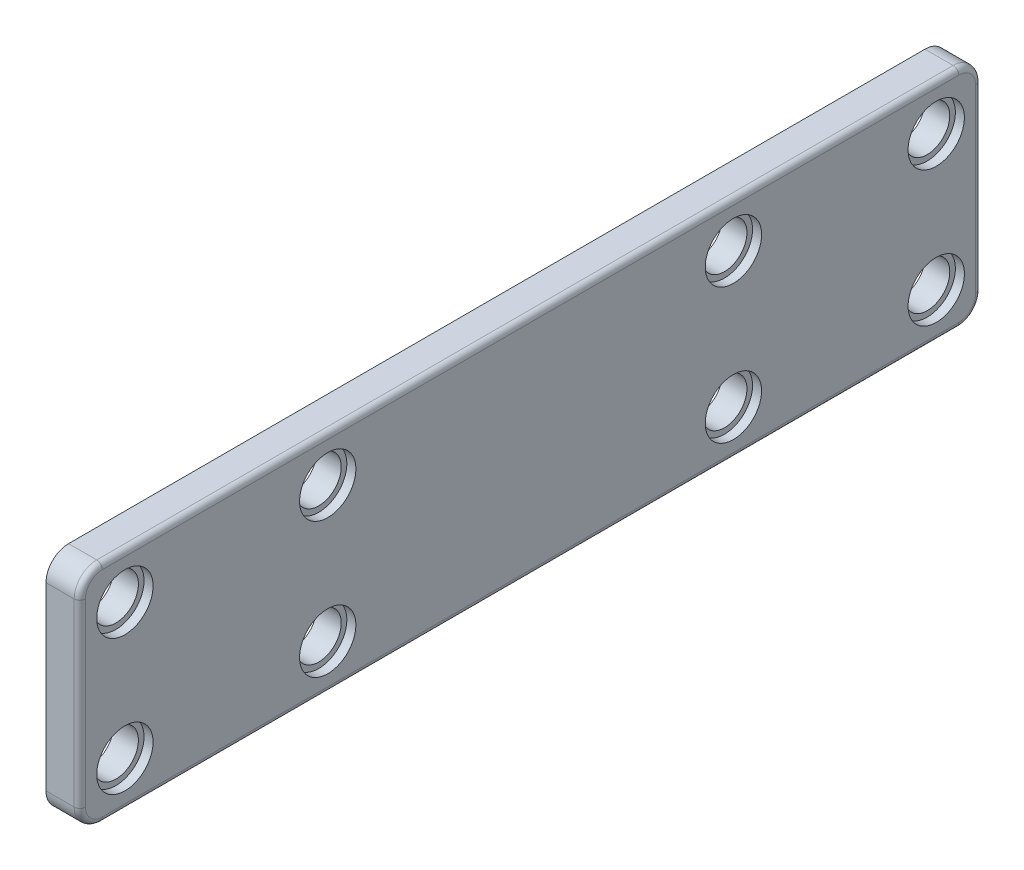
from build123d import *

# Parameters (mm, degrees)
SKETCH2_W            = 3
SKETCH2_H            = 20
BOSS_EXTRUDE2_DEPTH  = 80
FILLET3_R            = 2
FILLET4_R            = 2
FILLET5_R            = 2
FILLET6_R            = 2
LPATTERN1_COUNT      = 2
LPATTERN1_PITCH      = 18
LPATTERN1_COUNT_DIR2 = 2
LPATTERN1_PITCH_DIR2 = 12
FILLET7_R            = 0.5


with BuildPart() as part:
    # Sketch2 → Boss-Extrude2 (new body)
    with BuildSketch(Plane.XY):
        Rectangle(SKETCH2_W, SKETCH2_H)
    extrude(amount=BOSS_EXTRUDE2_DEPTH)

    # Fillet3
    fillet3_edges = [part.edges().sort_by_distance(p)[0] for p in [
        (0, 10, 80),
    ]]
    fillet(fillet3_edges, radius=FILLET3_R)

    # Fillet4
    fillet4_edges = [part.edges().sort_by_distance(p)[0] for p in [
        (0, -10, 80),
    ]]
    fillet(fillet4_edges, radius=FILLET4_R)

    # Fillet5
    fillet5_edges = [part.edges().sort_by_distance(p)[0] for p in [
        (0, 10, 0),
    ]]
    fillet(fillet5_edges, radius=FILLET5_R)

    # Fillet6
    fillet6_edges = [part.edges().sort_by_distance(p)[0] for p in [
        (0, -10, 0),
    ]]
    fillet(fillet6_edges, radius=FILLET6_R)

    # Sketch4 → CBORE for M5 Hex Head Bolt1 (revolve, cut)
    with BuildSketch(Plane(origin=(1.5, 6, 76), x_dir=(0, 0, -1), z_dir=(0, 1, 0))):
        Polygon((0, 0), (0, 5.178090033), (2, 4), (2, 0.8), (2.5, 0.8), (2.5, 0), align=None)
    cbore_for_m5_hex_head_bolt1 = revolve(axis=Axis((7.85, 6, 76), (-1, 0, 0)), mode=Mode.SUBTRACT)

    # LPattern1: CBORE for M5 Hex Head Bolt1 2 × 2
    with Locations(*[(0, -j * LPATTERN1_PITCH_DIR2, -i * LPATTERN1_PITCH) for i in range(LPATTERN1_COUNT) for j in range(LPATTERN1_COUNT_DIR2) if (i, j) != (0, 0)]):
        add(cbore_for_m5_hex_head_bolt1, mode=Mode.SUBTRACT)

    # Mirror16: CBORE for M5 Hex Head Bolt1 across plane
    add(cbore_for_m5_hex_head_bolt1.mirror(Plane.XY.offset(40)), mode=Mode.SUBTRACT)

    # Mirror16 copy 1 sketch → Mirror16 copy 1 (revolve, cut)
    with BuildSketch(Plane(origin=(1.5, -6, 4), x_dir=(0, 0, 1), z_dir=(0, 1, 0))):
        Polygon((0, 0), (0, -5.178090033), (2, -4), (2, -0.8), (2.5, -0.8), (2.5, 0), align=None)
    revolve(axis=Axis((7.85, -6, 4), (1, 0, 0)), mode=Mode.SUBTRACT)

    # Mirror16 copy 2 sketch → Mirror16 copy 2 (revolve, cut)
    with BuildSketch(Plane(origin=(1.5, 6, 22), x_dir=(0, 0, 1), z_dir=(0, 1, 0))):
        Polygon((0, 0), (0, -5.178090033), (2, -4), (2, -0.8), (2.5, -0.8), (2.5, 0), align=None)
    revolve(axis=Axis((7.85, 6, 22), (1, 0, 0)), mode=Mode.SUBTRACT)

    # Mirror16 copy 3 sketch → Mirror16 copy 3 (revolve, cut)
    with BuildSketch(Plane(origin=(1.5, -6, 22), x_dir=(0, 0, 1), z_dir=(0, 1, 0))):
        Polygon((0, 0), (0, -5.178090033), (2, -4), (2, -0.8), (2.5, -0.8), (2.5, 0), align=None)
    revolve(axis=Axis((7.85, -6, 22), (1, 0, 0)), mode=Mode.SUBTRACT)

    # Fillet7
    fillet7_edges = [part.edges().sort_by_distance(p)[0] for p in [
        (1.5, -9.414213562, 79.414213562),
        (1.5, 0, 80),
        (1.5, 9.414213562, 79.414213562),
        (1.5, 10, 40),
        (1.5, 9.414213562, 0.585786438),
        (1.5, 0, 0),
        (1.5, -9.414213562, 0.585786438),
        (1.5, -10, 40),
    ]]
    fillet(fillet7_edges, radius=FILLET7_R)


solid = part.part
